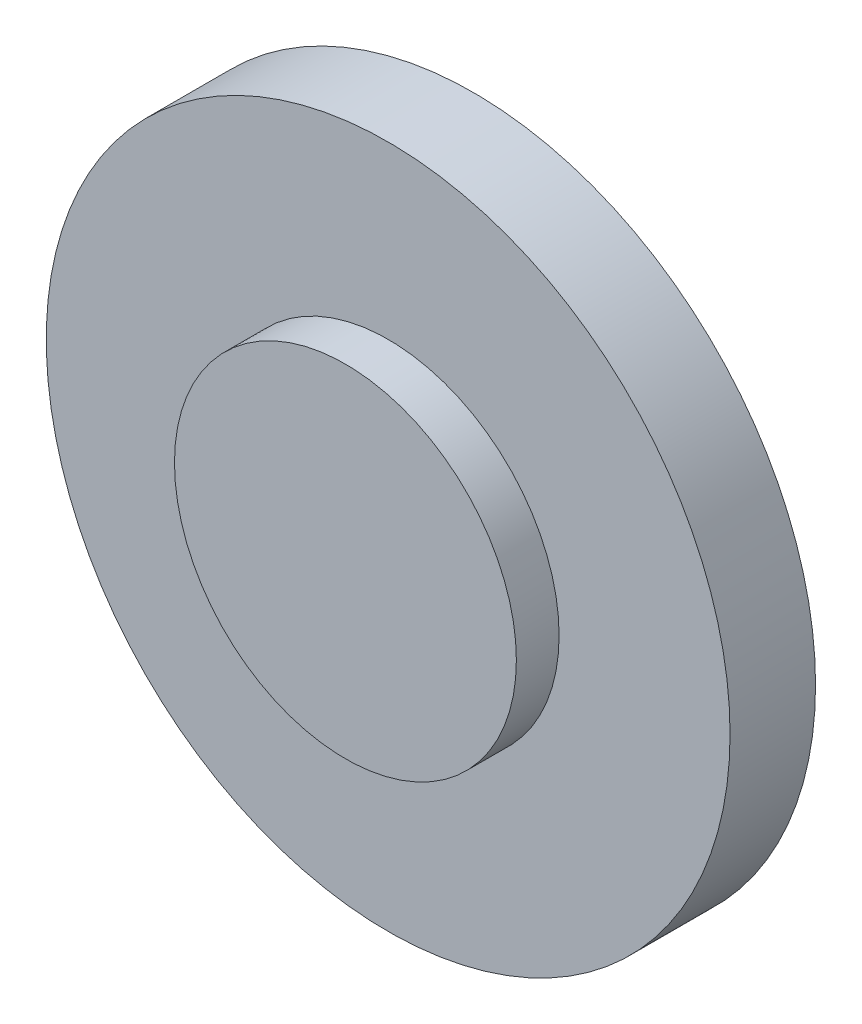
from build123d import *

# Parameters (mm, degrees)
ESBO_O1_R                = 4
RESSALTO_EXTRUS_O1_DEPTH = 1
ESBO_O2_R                = 2
RESSALTO_EXTRUS_O2_DEPTH = 0.5


with BuildPart() as part:
    # Esboço1 → Ressalto-extrusão1 (new body)
    with BuildSketch(Plane.XY):
        Circle(ESBO_O1_R)
    extrude(amount=RESSALTO_EXTRUS_O1_DEPTH)

    # Esboço2 → Ressalto-extrusão2 (add)
    with BuildSketch(Plane.XY.offset(1)):
        Circle(ESBO_O2_R)
    extrude(amount=RESSALTO_EXTRUS_O2_DEPTH)


solid = part.part
